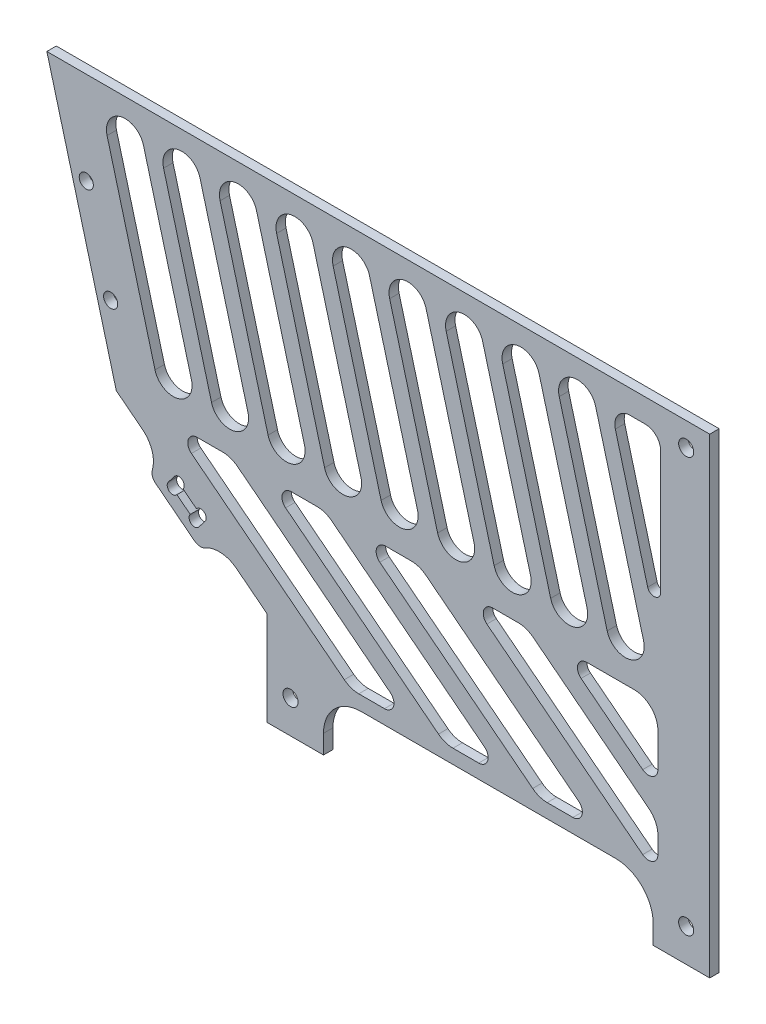
from build123d import *

# Parameters (mm, degrees)
EXTRUDE_1_DEPTH                = 2
SKETCH_2_R                     = 1.6
CUT_EXTRUDE_1_DEPTH            = 60
CUT_EXTRUDE_3_DEPTH            = 173.657320469
PATTERN_LINEAR_1_COUNT         = 9
PATTERN_LINEAR_1_PITCH         = 12
CUT_EXTRUDE_4_DEPTH            = 173.657320469
FILLET_1_R                     = 3.25
FILLET_2_R                     = 1.4
SKETCH_8_R                     = 1.5
CUT_EXTRUDE_6_DEPTH            = 173.657320469
SKETCH_12_R                    = 1.6
CUT_EXTRUDE_9_DEPTH            = 173.657320469
SKETCH_15_W                    = 70
SKETCH_15_H                    = 24
CUT_EXTRUDE_13_DEPTH           = 173.657320469
FILLET_10_R                    = 8
CUT_EXTRUDE_11_DEPTH           = 173.657320469
FILLET_5_R                     = 2
FILLET_6_R                     = 5
PATTERN_LINEAR_2_COUNT         = 3
PATTERN_LINEAR_2_PITCH         = 20
FILLET_5_OF_PATTERN_LINEAR_2_R = 2
FILLET_6_OF_PATTERN_LINEAR_2_R = 5
CUT_EXTRUDE_12_DEPTH           = 173.657320469
FILLET_8_R                     = 2
FILLET_9_R                     = 5
EXTRUDE_6_DEPTH                = 2
SKETCH_17_R                    = 1.15
CUT_EXTRUDE_16_DEPTH           = 173.657320469
FILLET_11_R                    = 6
FILLET_12_R                    = 2


with BuildPart() as part:
    # 草图1 → 凸台-拉伸1 (new body)
    with BuildSketch(Plane.XY):
        Polygon((46.735746389, -100), (140.735746389, -100), (140.735746389, 0), (0, 0), (14.737205584, -55), (46.735746389, -80), align=None)
    extrude(amount=EXTRUDE_1_DEPTH)

    # 草图2 → 切除-拉伸1 (cut)
    with BuildSketch(Plane(origin=(0, 0, 0), x_dir=(-1, 0, 0), z_dir=(0, 0, -1))):
        with Locations((-135.735746389, -93)):
            Circle(SKETCH_2_R)
        with Locations((-51.735746389, -93)):
            Circle(SKETCH_2_R)
    extrude(amount=-CUT_EXTRUDE_1_DEPTH, mode=Mode.SUBTRACT)

    # 草图5 → 切除-拉伸3 (cut, through all)
    with BuildSketch(Plane.XY.offset(2)):
        with BuildLine():
            ThreePointArc((22.965278296, -47.070552361), (25.793705421, -42.171572875), (30.692684907, -45))
            Line((30.692684907, -45), (20.510615594, -7))
            ThreePointArc((20.510615594, -7), (20.612691735, -7.513171412), (20.646912289, -8.03527618))
            ThreePointArc((20.646912289, -8.03527618), (17.169017058, -12.001055626), (12.783208984, -9.070552361))
            Line((12.783208984, -9.070552361), (22.965278296, -47.070552361))
        make_face()
        with BuildLine():
            ThreePointArc((20.646912289, -8.03527618), (20.612691735, -7.513171412), (20.510615594, -7))
            Line((20.510615594, -7), (12.783208984, -9.070552361))
            ThreePointArc((12.783208984, -9.070552361), (17.169017058, -12.001055626), (20.646912289, -8.03527618))
        make_face()
        with BuildLine():
            Line((12.783208984, -9.070552361), (20.510615594, -7))
            ThreePointArc((20.510615594, -7), (15.611636109, -4.171572875), (12.783208984, -9.070552361))
        make_face()
        with BuildLine():
            ThreePointArc((30.828981602, -46.03527618), (30.794761047, -45.513171412), (30.692684907, -45))
            Line((30.692684907, -45), (22.965278296, -47.070552361))
            ThreePointArc((22.965278296, -47.070552361), (27.351086371, -50.001055626), (30.828981602, -46.03527618))
        make_face()
        with BuildLine():
            Line((22.965278296, -47.070552361), (30.692684907, -45))
            ThreePointArc((30.692684907, -45), (25.793705421, -42.171572875), (22.965278296, -47.070552361))
        make_face()
    cut_extrude_3 = extrude(amount=-CUT_EXTRUDE_3_DEPTH, mode=Mode.SUBTRACT)

    # 阵列(线性)1: 切除-拉伸3 ×9
    with Locations(*[(i * PATTERN_LINEAR_1_PITCH, 0, 0) for i in range(1, PATTERN_LINEAR_1_COUNT)]):
        add(cut_extrude_3, mode=Mode.SUBTRACT)

    # 草图6 → 切除-拉伸4 (cut, through all)
    with BuildSketch(Plane.XY.offset(2)):
        Polygon((119.598183841, -5), (130.316151538, -45), (130.316151538, -5), align=None)
    extrude(amount=-CUT_EXTRUDE_4_DEPTH, mode=Mode.SUBTRACT)

    # 圆角1
    fillet_1_edges = [part.edges().sort_by_distance(p)[0] for p in [
        (119.598183841, -5, 1),
        (130.316151538, -5, 1),
    ]]
    fillet(fillet_1_edges, radius=FILLET_1_R)

    # 圆角2
    fillet_2_edges = [part.edges().sort_by_distance(p)[0] for p in [
        (130.316151538, -45, 1),
    ]]
    fillet(fillet_2_edges, radius=FILLET_2_R)

    # 草图8 → 切除-拉伸6 (cut, through all)
    with BuildSketch(Plane.XY.offset(2)):
        with Locations((8.371030173, -19.65)):
            Circle(SKETCH_8_R)
        with Locations((13.547411075, -38.968516526)):
            Circle(SKETCH_8_R)
    extrude(amount=-CUT_EXTRUDE_6_DEPTH, mode=Mode.SUBTRACT)

    # 草图12 → 切除-拉伸9 (cut, through all)
    with BuildSketch(Plane.XY.offset(2)):
        with Locations((135.735746389, -5)):
            Circle(SKETCH_12_R)
    extrude(amount=-CUT_EXTRUDE_9_DEPTH, mode=Mode.SUBTRACT)

    # 草图15 → 切除-拉伸13 (cut, through all)
    with BuildSketch(Plane.XY.offset(2)):
        with Locations((93.735746389, -100)):
            Rectangle(SKETCH_15_W, SKETCH_15_H)
    extrude(amount=-CUT_EXTRUDE_13_DEPTH, mode=Mode.SUBTRACT)

    # 圆角10
    fillet_10_edges = [part.edges().sort_by_distance(p)[0] for p in [
        (128.735746389, -88, 1),
        (58.735746389, -88, 1),
    ]]
    fillet(fillet_10_edges, radius=FILLET_10_R)

    # 草图13 → 切除-拉伸11 (cut, through all)
    with BuildSketch(Plane.XY.offset(2)):
        Polygon((26.107090302, -55), (64.505339268, -85), (77.499493232, -85), (39.101244266, -55), align=None)
    cut_extrude_11 = extrude(amount=-CUT_EXTRUDE_11_DEPTH, mode=Mode.SUBTRACT)

    # 圆角5
    fillet_5_edges = [part.edges().sort_by_distance(p)[0] for p in [
        (26.107090302, -55, 1),
        (77.499493232, -85, 1),
    ]]
    fillet(fillet_5_edges, radius=FILLET_5_R)

    # 圆角6
    fillet_6_edges = [part.edges().sort_by_distance(p)[0] for p in [
        (39.101244266, -55, 1),
        (64.505339268, -85, 1),
    ]]
    fillet(fillet_6_edges, radius=FILLET_6_R)

    # 阵列(线性)2: 切除-拉伸11 ×3
    with Locations(*[(i * PATTERN_LINEAR_2_PITCH, 0, 0) for i in range(1, PATTERN_LINEAR_2_COUNT)]):
        add(cut_extrude_11, mode=Mode.SUBTRACT)

    # 圆角5 of 阵列(线性)2
    fillet_5_of_pattern_linear_2_edges = [part.edges().sort_by_distance(p)[0] for p in [
        (46.107090302, -55, 1),
        (97.499493232, -85, 1),
        (66.107090302, -55, 1),
        (117.499493232, -85, 1),
    ]]
    fillet(fillet_5_of_pattern_linear_2_edges, radius=FILLET_5_OF_PATTERN_LINEAR_2_R)

    # 圆角6 of 阵列(线性)2
    fillet_6_of_pattern_linear_2_edges = [part.edges().sort_by_distance(p)[0] for p in [
        (59.101244266, -55, 1),
        (84.505339268, -85, 1),
        (79.101244266, -55, 1),
        (104.505339268, -85, 1),
    ]]
    fillet(fillet_6_of_pattern_linear_2_edges, radius=FILLET_6_OF_PATTERN_LINEAR_2_R)

    # 草图14 → 切除-拉伸12 (cut, through all)
    with BuildSketch(Plane.XY.offset(2)):
        Polygon((88.846859739, -55), (129.735746389, -86.945899423), (129.735746389, -76.793753703), (101.841013703, -55), align=None)
        Polygon((108.841614151, -55), (129.735746389, -71.324285196), (129.735746389, -55), align=None)
    extrude(amount=-CUT_EXTRUDE_12_DEPTH, mode=Mode.SUBTRACT)

    # 圆角8
    fillet_8_edges = [part.edges().sort_by_distance(p)[0] for p in [
        (108.841614151, -55, 1),
        (129.735746389, -71.324285196, 1),
        (88.846859739, -55, 1),
        (129.735746389, -86.945899423, 1),
    ]]
    fillet(fillet_8_edges, radius=FILLET_8_R)

    # 圆角9
    fillet_9_edges = [part.edges().sort_by_distance(p)[0] for p in [
        (129.735746389, -55, 1),
        (101.841013703, -55, 1),
        (129.735746389, -76.793753703, 1),
    ]]
    fillet(fillet_9_edges, radius=FILLET_9_R)

    # 草图18 → 凸台-拉伸6 (add)
    with BuildSketch(Plane(origin=(0, 0, 0), x_dir=(-1, 0, 0), z_dir=(0, 0, -1))):
        Polygon((-35.619490554, -71.315029096), (-32.541183178, -75.255082864), (-21.903038004, -66.943652947), (-24.981345381, -63.003599179), align=None)
    extrude(amount=-EXTRUDE_6_DEPTH)

    # 草图17 → 切除-拉伸16 (cut, through all)
    with BuildSketch(Plane.XY):
        with BuildLine():
            ThreePointArc((29.171960855, -65.284011979), (28.396364233, -64.196665617), (27.115748488, -64.576001282))
            Line((27.115748488, -64.576001282), (28.928173222, -65.992022676))
            ThreePointArc((28.928173222, -65.992022676), (29.109307217, -65.658415357), (29.171960855, -65.284011979))
        make_face()
        with BuildLine():
            Line((28.928173222, -65.992022676), (27.115748488, -64.576001282))
            ThreePointArc((27.115748488, -64.576001282), (26.87398919, -65.215740047), (27.038219724, -65.879623754))
            ThreePointArc((27.038219724, -65.879623754), (27.40629938, -66.072022733), (27.682029814, -66.382623324))
            ThreePointArc((27.682029814, -66.382623324), (28.3659243, -66.381367504), (28.928173222, -65.992022676))
        make_face()
        with BuildLine():
            ThreePointArc((27.038219724, -65.879623754), (26.87398919, -65.215740047), (27.115748488, -64.576001282))
            Line((27.115748488, -64.576001282), (25.792076316, -66.270224403))
            ThreePointArc((25.792076316, -66.270224403), (26.354325238, -65.880879574), (27.038219724, -65.879623754))
        make_face()
        with BuildLine():
            ThreePointArc((27.038219724, -65.879623754), (26.354325238, -65.880879574), (25.792076316, -66.270224403))
            Line((25.792076316, -66.270224403), (27.60450105, -67.686245796))
            ThreePointArc((27.60450105, -67.686245796), (27.785635045, -67.352638477), (27.848288683, -66.978235099))
            ThreePointArc((27.848288683, -66.978235099), (27.805944383, -66.669044463), (27.682029814, -66.382623324))
            ThreePointArc((27.682029814, -66.382623324), (27.313950158, -66.190224346), (27.038219724, -65.879623754))
        make_face()
        with BuildLine():
            Line((27.60450105, -67.686245796), (25.792076316, -66.270224403))
            ThreePointArc((25.792076316, -66.270224403), (25.990277986, -67.884447466), (27.60450105, -67.686245796))
        make_face()
        with Locations((26.698288683, -66.978235099)):
            Circle(SKETCH_17_R)
        with Locations((28.021960855, -65.284011979)):
            Circle(SKETCH_17_R)
        with BuildLine():
            Line((31.765011935, -68.208403987), (28.928173222, -65.992022676))
            ThreePointArc((28.928173222, -65.992022676), (28.3659243, -66.381367504), (27.682029814, -66.382623324))
            ThreePointArc((27.682029814, -66.382623324), (27.805944383, -66.669044463), (27.848288683, -66.978235099))
            ThreePointArc((27.848288683, -66.978235099), (27.785635045, -67.352638477), (27.60450105, -67.686245796))
            Line((27.60450105, -67.686245796), (30.441339763, -69.902627107))
            ThreePointArc((30.441339763, -69.902627107), (31.003588684, -69.513282279), (31.68748317, -69.512026459))
            ThreePointArc((31.68748317, -69.512026459), (31.523252636, -68.848142751), (31.765011935, -68.208403987))
        make_face()
        with BuildLine():
            Line((33.577436668, -69.62442538), (31.765011935, -68.208403987))
            ThreePointArc((31.765011935, -68.208403987), (31.523252636, -68.848142751), (31.68748317, -69.512026459))
            ThreePointArc((31.68748317, -69.512026459), (32.055562826, -69.704425437), (32.331293261, -70.015026028))
            ThreePointArc((32.331293261, -70.015026028), (33.015187746, -70.013770208), (33.577436668, -69.62442538))
        make_face()
        with BuildLine():
            ThreePointArc((32.331293261, -70.015026028), (31.963213605, -69.82262705), (31.68748317, -69.512026459))
            ThreePointArc((31.68748317, -69.512026459), (31.003588684, -69.513282279), (30.441339763, -69.902627107))
            Line((30.441339763, -69.902627107), (32.253764496, -71.3186485))
            ThreePointArc((32.253764496, -71.3186485), (32.434898491, -70.985041181), (32.497552129, -70.610637804))
            ThreePointArc((32.497552129, -70.610637804), (32.45520783, -70.301447167), (32.331293261, -70.015026028))
        make_face()
        with BuildLine():
            ThreePointArc((33.821224301, -68.916414683), (33.045627679, -67.829068321), (31.765011935, -68.208403987))
            Line((31.765011935, -68.208403987), (33.577436668, -69.62442538))
            ThreePointArc((33.577436668, -69.62442538), (33.758570663, -69.290818061), (33.821224301, -68.916414683))
        make_face()
        with BuildLine():
            Line((32.253764496, -71.3186485), (30.441339763, -69.902627107))
            ThreePointArc((30.441339763, -69.902627107), (30.639541433, -71.51685017), (32.253764496, -71.3186485))
        make_face()
        with BuildLine():
            Line((32.253764496, -71.3186485), (33.577436668, -69.62442538))
            ThreePointArc((33.577436668, -69.62442538), (33.015187746, -70.013770208), (32.331293261, -70.015026028))
            ThreePointArc((32.331293261, -70.015026028), (32.45520783, -70.301447167), (32.497552129, -70.610637804))
            ThreePointArc((32.497552129, -70.610637804), (32.434898491, -70.985041181), (32.253764496, -71.3186485))
        make_face()
        with Locations((32.671224301, -68.916414683)):
            Circle(SKETCH_17_R)
        with Locations((31.347552129, -70.610637804)):
            Circle(SKETCH_17_R)
    extrude(amount=CUT_EXTRUDE_16_DEPTH, mode=Mode.SUBTRACT)

    # 圆角11
    # the kernel refuses this fillet: 6 mm, written as the material it adds along each edge
    with BuildSketch(Plane(origin=(24.981345381, -63.003599179, 0), x_dir=(-0.7880107536067251, 0.6156614753256543, 0), z_dir=(0, 0, 1))) as fillet_11_piece_1:
        with BuildLine():
            CenterArc((5.916079783, 6), FILLET_11_R, 189.594068227, 80.405931773)
            Line((0, 5), (-0.118321596, 4.98))
            ThreePointArc((-0.118321596, 4.98), (-0.12, 2.5), (-0.12, 0))
            Line((-0.12, 0), (0, -0.12))
            Line((0, -0.12), (5.916079783, -0.12))
            Line((5.916079783, -0.12), (5.916079783, 0))
        make_face()
    extrude(amount=2)
    with BuildSketch(Plane(origin=(35.619490554, -71.315029096, 0), x_dir=(0.7880107536067248, -0.6156614753256546, 0), z_dir=(0, 0, 1))) as fillet_11_piece_2:
        with BuildLine():
            CenterArc((5.916079783, -6), FILLET_11_R, 90, 80.405931773)
            Line((0, -5), (-0.118321596, -4.98))
            ThreePointArc((-0.118321596, -4.98), (-0.12, -2.5), (-0.12, 0))
            Line((-0.12, 0), (0, 0.12))
            Line((0, 0.12), (5.916079783, 0.12))
            Line((5.916079783, 0.12), (5.916079783, 0))
        make_face()
    extrude(amount=2)

    # 圆角12
    fillet_12_edges = [part.edges().sort_by_distance(p)[0] for p in [
        (32.541183178, -75.255082864, 1),
        (21.903038004, -66.943652947, 1),
    ]]
    fillet(fillet_12_edges, radius=FILLET_12_R)


solid = part.part
